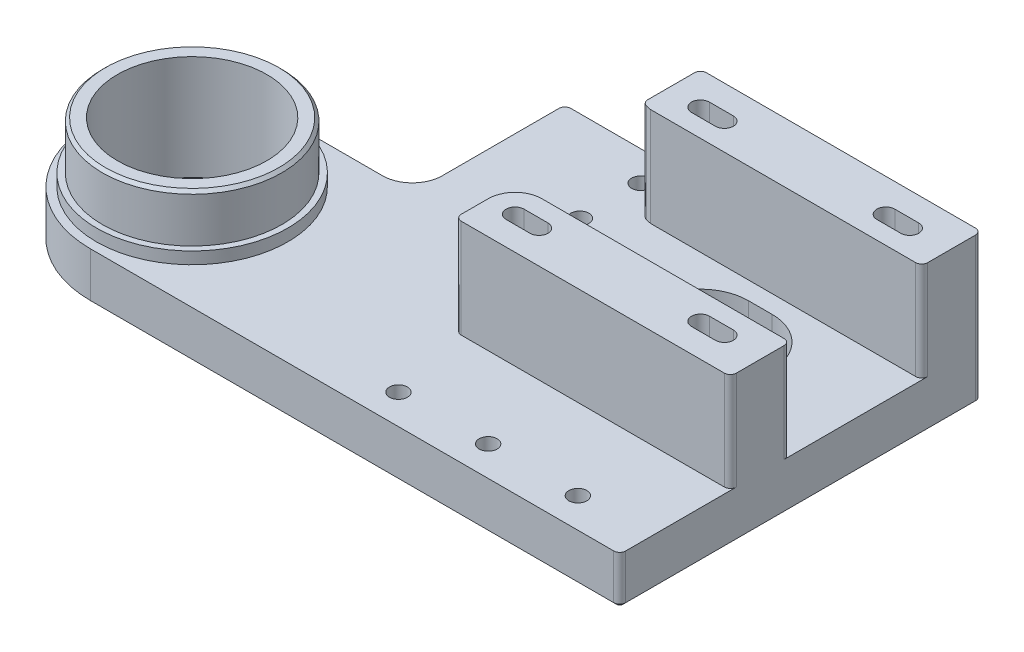
from build123d import *
from OCP.BRepFilletAPI import BRepFilletAPI_MakeChamfer
from build123d.topology import SkipClean

# Parameters (mm, degrees)
SKETCH1_R           = 1.425
SKETCH1_R_2         = 12.5
SKETCH1_R_3         = 1.5
BOSS_EXTRUDE1_DEPTH = 8
SKETCH11_R          = 3
CUT_EXTRUDE1_DEPTH  = 2
CHAMFER6_SIZE       = 0.5
CHAMFER6_SIZE2      = 1.37373871
CUT_EXTRUDE2_DEPTH  = 2
CHAMFER7_SIZE       = 0.5
CHAMFER7_SIZE2      = 1.37373871
SKETCH2_R           = 16
SKETCH2_R_2         = 12.5
BOSS_EXTRUDE2_DEPTH = 2
SKETCH5_R           = 3.425
SKETCH5_R_2         = 1.425
BOSS_EXTRUDE3_DEPTH = 2.5
CHAMFER3_SIZE       = 1
BOSS_EXTRUDE5_DEPTH = 16.5
BOSS_EXTRUDE6_DEPTH = 16.5
FILLET5_R           = 18
SKETCH6_R           = 15
SKETCH6_R_2         = 12.5
BOSS_EXTRUDE4_DEPTH = 8
FILLET8_R           = 4
CHAMFER5_SIZE       = 0.5
FILLET6_R           = 5
FILLET9_R           = 1
CHAMFER2_SIZE       = 0.5


with BuildPart() as part:
    # Sketch1 → Boss-Extrude1 (new body)
    with BuildSketch(Plane(origin=(0, 0, 0), x_dir=(1, 0, 0), z_dir=(0, 1, 0))):
        Polygon((-17.5, 17.5), (-17.5, -17.5), (89, -17.5), (89, 43), (19.331697659, 43), (19.331697659, 17.5), align=None)
        with Locations(Location((47, 20, 0), (0, 0, 270))):
            Circle(SKETCH1_R, mode=Mode.SUBTRACT)
        with Locations(Location((0, 0, 0), (0, 0, 270))):
            Circle(SKETCH1_R_2, mode=Mode.SUBTRACT)
        with Locations(Location((47, -12.5, 0), (0, 0, 270))):
            Circle(SKETCH1_R_3, mode=Mode.SUBTRACT)
        with Locations(Location((62, -12.5, 0), (0, 0, 270))):
            Circle(SKETCH1_R_3, mode=Mode.SUBTRACT)
        with Locations(Location((77, -12.5, 0), (0, 0, 270))):
            Circle(SKETCH1_R_3, mode=Mode.SUBTRACT)
        with Locations(Location((37, 38, 0), (0, 0, 270))):
            Circle(SKETCH1_R_3, mode=Mode.SUBTRACT)
        with Locations(Location((37, 27.837285004, 0), (0, 0, 270))):
            Circle(SKETCH1_R_3, mode=Mode.SUBTRACT)
        with BuildLine():
            Line((47.5, 39), (51.5, 39))
            ThreePointArc((51.5, 39), (53, 37.5), (51.5, 36))
            Line((51.5, 36), (47.5, 36))
            ThreePointArc((47.5, 36), (46, 37.5), (47.5, 39))
        make_face(mode=Mode.SUBTRACT)
        with BuildLine():
            Line((78.5, 39), (82.5, 39))
            ThreePointArc((82.5, 39), (84, 37.5), (82.5, 36))
            Line((82.5, 36), (78.5, 36))
            ThreePointArc((78.5, 36), (77, 37.5), (78.5, 39))
        make_face(mode=Mode.SUBTRACT)
        with BuildLine():
            Line((47.5, 8), (51.5, 8))
            ThreePointArc((51.5, 8), (53, 6.5), (51.5, 5))
            Line((51.5, 5), (47.5, 5))
            ThreePointArc((47.5, 5), (46, 6.5), (47.5, 8))
        make_face(mode=Mode.SUBTRACT)
        with BuildLine():
            Line((78.5, 8), (82.5, 8))
            ThreePointArc((82.5, 8), (84, 6.5), (82.5, 5))
            Line((82.5, 5), (78.5, 5))
            ThreePointArc((78.5, 5), (77, 6.5), (78.5, 8))
        make_face(mode=Mode.SUBTRACT)
        with BuildLine():
            Line((63, 30), (67, 30))
            ThreePointArc((67, 30), (75, 22), (67, 14))
            Line((67, 14), (63, 14))
            ThreePointArc((63, 14), (55, 22), (63, 30))
        make_face(mode=Mode.SUBTRACT)
    extrude(amount=BOSS_EXTRUDE1_DEPTH)

    # Sketch11 → Cut-Extrude1 (cut)
    with BuildSketch(Plane.XZ):
        with Locations(Location((47, 12.5, 0), (0, 0, 270))):
            Circle(SKETCH11_R)
        with Locations(Location((62, 12.5, 0), (0, 0, 270))):
            Circle(SKETCH11_R)
        with Locations(Location((77, 12.5, 0), (0, 0, 270))):
            Circle(SKETCH11_R)
        with Locations(Location((37, -27.837285004, 0), (0, 0, 270))):
            Circle(SKETCH11_R)
        with Locations(Location((37, -38, 0), (0, 0, 270))):
            Circle(SKETCH11_R)
    extrude(amount=-CUT_EXTRUDE1_DEPTH, mode=Mode.SUBTRACT)

    # Chamfer6: one chamfer whose edges measure the first distance from different faces: ONE call of the kernel's chamfer builder (chamfer() names one face for all edges)
    chamfer6_edges_1 = [part.edges().sort_by_distance(p)[0] for p in [
        (37, 2, -24.837285004),
    ]]
    chamfer6_side_1 = [part.faces().sort_by_distance(p)[0] for p in [
        (37, 1, -24.837285004),
    ]]
    chamfer6_edges_2 = [part.edges().sort_by_distance(p)[0] for p in [
        (37, 2, -35),
    ]]
    chamfer6_side_2 = [part.faces().sort_by_distance(p)[0] for p in [
        (37, 1, -35),
    ]]
    chamfer6_edges_3 = [part.edges().sort_by_distance(p)[0] for p in [
        (77, 2, 15.5),
    ]]
    chamfer6_side_3 = [part.faces().sort_by_distance(p)[0] for p in [
        (77, 1, 15.5),
    ]]
    chamfer6_edges_4 = [part.edges().sort_by_distance(p)[0] for p in [
        (62, 2, 15.5),
    ]]
    chamfer6_side_4 = [part.faces().sort_by_distance(p)[0] for p in [
        (62, 1, 15.5),
    ]]
    chamfer6_edges_5 = [part.edges().sort_by_distance(p)[0] for p in [
        (47, 2, 15.5),
    ]]
    chamfer6_side_5 = [part.faces().sort_by_distance(p)[0] for p in [
        (47, 1, 15.5),
    ]]
    chamfer6 = BRepFilletAPI_MakeChamfer(part.part.solid().wrapped)
    for e in chamfer6_edges_1:
        chamfer6.Add(CHAMFER6_SIZE, CHAMFER6_SIZE2, e.wrapped, chamfer6_side_1[0].wrapped)  # the first distance lies on this face
    for e in chamfer6_edges_2:
        chamfer6.Add(CHAMFER6_SIZE, CHAMFER6_SIZE2, e.wrapped, chamfer6_side_2[0].wrapped)  # the first distance lies on this face
    for e in chamfer6_edges_3:
        chamfer6.Add(CHAMFER6_SIZE, CHAMFER6_SIZE2, e.wrapped, chamfer6_side_3[0].wrapped)  # the first distance lies on this face
    for e in chamfer6_edges_4:
        chamfer6.Add(CHAMFER6_SIZE, CHAMFER6_SIZE2, e.wrapped, chamfer6_side_4[0].wrapped)  # the first distance lies on this face
    for e in chamfer6_edges_5:
        chamfer6.Add(CHAMFER6_SIZE, CHAMFER6_SIZE2, e.wrapped, chamfer6_side_5[0].wrapped)  # the first distance lies on this face
    add(Compound.cast(chamfer6.Shape()), mode=Mode.REPLACE)

    # Sketch12 → Cut-Extrude2 (cut)
    with BuildSketch(Plane.XZ):
        with BuildLine():
            Line((47.5, -3), (51.5, -3))
            ThreePointArc((51.5, -3), (55, -6.5), (51.5, -10))
            Line((51.5, -10), (47.5, -10))
            ThreePointArc((47.5, -10), (44, -6.5), (47.5, -3))
        make_face()
        with BuildLine():
            Line((78.5, -3), (82.5, -3))
            ThreePointArc((82.5, -3), (86, -6.5), (82.5, -10))
            Line((82.5, -10), (78.5, -10))
            ThreePointArc((78.5, -10), (75, -6.5), (78.5, -3))
        make_face()
        with BuildLine():
            Line((47.5, -34), (51.5, -34))
            ThreePointArc((51.5, -34), (55, -37.5), (51.5, -41))
            Line((51.5, -41), (47.5, -41))
            ThreePointArc((47.5, -41), (44, -37.5), (47.5, -34))
        make_face()
        with BuildLine():
            Line((78.5, -34), (82.5, -34))
            ThreePointArc((82.5, -34), (86, -37.5), (82.5, -41))
            Line((82.5, -41), (78.5, -41))
            ThreePointArc((78.5, -41), (75, -37.5), (78.5, -34))
        make_face()
    extrude(amount=-CUT_EXTRUDE2_DEPTH, mode=Mode.SUBTRACT)

    # Chamfer7: one chamfer whose edges measure the first distance from different faces: ONE call of the kernel's chamfer builder (chamfer() names one face for all edges)
    chamfer7_edges_1 = [part.edges().sort_by_distance(p)[0] for p in [
        (75, 2, -6.5),
    ]]
    chamfer7_side_1 = [part.faces().sort_by_distance(p)[0] for p in [
        (75, 1, -6.5),
    ]]
    chamfer7_edges_2 = [part.edges().sort_by_distance(p)[0] for p in [
        (80.5, 2, -3),
    ]]
    chamfer7_side_2 = [part.faces().sort_by_distance(p)[0] for p in [
        (80.5, 1, -3),
    ]]
    chamfer7_edges_3 = [part.edges().sort_by_distance(p)[0] for p in [
        (86, 2, -6.5),
    ]]
    chamfer7_side_3 = [part.faces().sort_by_distance(p)[0] for p in [
        (86, 1, -6.5),
    ]]
    chamfer7_edges_4 = [part.edges().sort_by_distance(p)[0] for p in [
        (80.5, 2, -10),
    ]]
    chamfer7_side_4 = [part.faces().sort_by_distance(p)[0] for p in [
        (80.5, 1, -10),
    ]]
    chamfer7_edges_5 = [part.edges().sort_by_distance(p)[0] for p in [
        (44, 2, -37.5),
    ]]
    chamfer7_side_5 = [part.faces().sort_by_distance(p)[0] for p in [
        (44, 1, -37.5),
    ]]
    chamfer7_edges_6 = [part.edges().sort_by_distance(p)[0] for p in [
        (49.5, 2, -34),
    ]]
    chamfer7_side_6 = [part.faces().sort_by_distance(p)[0] for p in [
        (49.5, 1, -34),
    ]]
    chamfer7_edges_7 = [part.edges().sort_by_distance(p)[0] for p in [
        (55, 2, -37.5),
    ]]
    chamfer7_side_7 = [part.faces().sort_by_distance(p)[0] for p in [
        (55, 1, -37.5),
    ]]
    chamfer7_edges_8 = [part.edges().sort_by_distance(p)[0] for p in [
        (49.5, 2, -41),
    ]]
    chamfer7_side_8 = [part.faces().sort_by_distance(p)[0] for p in [
        (49.5, 1, -41),
    ]]
    chamfer7_edges_9 = [part.edges().sort_by_distance(p)[0] for p in [
        (75, 2, -37.5),
    ]]
    chamfer7_side_9 = [part.faces().sort_by_distance(p)[0] for p in [
        (75, 1, -37.5),
    ]]
    chamfer7_edges_10 = [part.edges().sort_by_distance(p)[0] for p in [
        (80.5, 2, -34),
    ]]
    chamfer7_side_10 = [part.faces().sort_by_distance(p)[0] for p in [
        (80.5, 1, -34),
    ]]
    chamfer7_edges_11 = [part.edges().sort_by_distance(p)[0] for p in [
        (86, 2, -37.5),
    ]]
    chamfer7_side_11 = [part.faces().sort_by_distance(p)[0] for p in [
        (86, 1, -37.5),
    ]]
    chamfer7_edges_12 = [part.edges().sort_by_distance(p)[0] for p in [
        (80.5, 2, -41),
    ]]
    chamfer7_side_12 = [part.faces().sort_by_distance(p)[0] for p in [
        (80.5, 1, -41),
    ]]
    chamfer7_edges_13 = [part.edges().sort_by_distance(p)[0] for p in [
        (44, 2, -6.5),
    ]]
    chamfer7_side_13 = [part.faces().sort_by_distance(p)[0] for p in [
        (44, 1, -6.5),
    ]]
    chamfer7_edges_14 = [part.edges().sort_by_distance(p)[0] for p in [
        (49.5, 2, -3),
    ]]
    chamfer7_side_14 = [part.faces().sort_by_distance(p)[0] for p in [
        (49.5, 1, -3),
    ]]
    chamfer7_edges_15 = [part.edges().sort_by_distance(p)[0] for p in [
        (55, 2, -6.5),
    ]]
    chamfer7_side_15 = [part.faces().sort_by_distance(p)[0] for p in [
        (55, 1, -6.5),
    ]]
    chamfer7_edges_16 = [part.edges().sort_by_distance(p)[0] for p in [
        (49.5, 2, -10),
    ]]
    chamfer7_side_16 = [part.faces().sort_by_distance(p)[0] for p in [
        (49.5, 1, -10),
    ]]
    chamfer7 = BRepFilletAPI_MakeChamfer(part.part.solid().wrapped)
    for e in chamfer7_edges_1:
        chamfer7.Add(CHAMFER7_SIZE, CHAMFER7_SIZE2, e.wrapped, chamfer7_side_1[0].wrapped)  # the first distance lies on this face
    for e in chamfer7_edges_2:
        chamfer7.Add(CHAMFER7_SIZE, CHAMFER7_SIZE2, e.wrapped, chamfer7_side_2[0].wrapped)  # the first distance lies on this face
    for e in chamfer7_edges_3:
        chamfer7.Add(CHAMFER7_SIZE, CHAMFER7_SIZE2, e.wrapped, chamfer7_side_3[0].wrapped)  # the first distance lies on this face
    for e in chamfer7_edges_4:
        chamfer7.Add(CHAMFER7_SIZE, CHAMFER7_SIZE2, e.wrapped, chamfer7_side_4[0].wrapped)  # the first distance lies on this face
    for e in chamfer7_edges_5:
        chamfer7.Add(CHAMFER7_SIZE, CHAMFER7_SIZE2, e.wrapped, chamfer7_side_5[0].wrapped)  # the first distance lies on this face
    for e in chamfer7_edges_6:
        chamfer7.Add(CHAMFER7_SIZE, CHAMFER7_SIZE2, e.wrapped, chamfer7_side_6[0].wrapped)  # the first distance lies on this face
    for e in chamfer7_edges_7:
        chamfer7.Add(CHAMFER7_SIZE, CHAMFER7_SIZE2, e.wrapped, chamfer7_side_7[0].wrapped)  # the first distance lies on this face
    for e in chamfer7_edges_8:
        chamfer7.Add(CHAMFER7_SIZE, CHAMFER7_SIZE2, e.wrapped, chamfer7_side_8[0].wrapped)  # the first distance lies on this face
    for e in chamfer7_edges_9:
        chamfer7.Add(CHAMFER7_SIZE, CHAMFER7_SIZE2, e.wrapped, chamfer7_side_9[0].wrapped)  # the first distance lies on this face
    for e in chamfer7_edges_10:
        chamfer7.Add(CHAMFER7_SIZE, CHAMFER7_SIZE2, e.wrapped, chamfer7_side_10[0].wrapped)  # the first distance lies on this face
    for e in chamfer7_edges_11:
        chamfer7.Add(CHAMFER7_SIZE, CHAMFER7_SIZE2, e.wrapped, chamfer7_side_11[0].wrapped)  # the first distance lies on this face
    for e in chamfer7_edges_12:
        chamfer7.Add(CHAMFER7_SIZE, CHAMFER7_SIZE2, e.wrapped, chamfer7_side_12[0].wrapped)  # the first distance lies on this face
    for e in chamfer7_edges_13:
        chamfer7.Add(CHAMFER7_SIZE, CHAMFER7_SIZE2, e.wrapped, chamfer7_side_13[0].wrapped)  # the first distance lies on this face
    for e in chamfer7_edges_14:
        chamfer7.Add(CHAMFER7_SIZE, CHAMFER7_SIZE2, e.wrapped, chamfer7_side_14[0].wrapped)  # the first distance lies on this face
    for e in chamfer7_edges_15:
        chamfer7.Add(CHAMFER7_SIZE, CHAMFER7_SIZE2, e.wrapped, chamfer7_side_15[0].wrapped)  # the first distance lies on this face
    for e in chamfer7_edges_16:
        chamfer7.Add(CHAMFER7_SIZE, CHAMFER7_SIZE2, e.wrapped, chamfer7_side_16[0].wrapped)  # the first distance lies on this face
    add(Compound.cast(chamfer7.Shape()), mode=Mode.REPLACE)

    # Sketch2 → Boss-Extrude2 (add)
    with BuildSketch(Plane.XZ.offset(-8)):
        with Locations(Location((0, 0, 0), (0, 0, 270))):
            Circle(SKETCH2_R)
        with Locations(Location((0, 0, 0), (0, 0, 270))):
            Circle(SKETCH2_R_2, mode=Mode.SUBTRACT)
    extrude(amount=-BOSS_EXTRUDE2_DEPTH)

    # Sketch5 → Boss-Extrude3 (add)
    with SkipClean():  # the faces are left unmerged after this step: merging them gives an invalid solid
        with BuildSketch(Plane(origin=(0, 8, 0), x_dir=(1, 0, 0), z_dir=(0, 1, 0))):
            with Locations(Location((47, 20, 0), (0, 0, 270))):
                Circle(SKETCH5_R)
            with Locations(Location((47, 20, 0), (0, 0, 270))):
                Circle(SKETCH5_R_2, mode=Mode.SUBTRACT)
        extrude(amount=BOSS_EXTRUDE3_DEPTH)

    # Chamfer3
    chamfer3_edges = [part.edges().sort_by_distance(p)[0] for p in [
        (47, 10.5, -23.425),
    ]]
    chamfer(chamfer3_edges, length=CHAMFER3_SIZE)

    # Sketch7 → Boss-Extrude5 (add)
    # profile 1 of 4: a face of its own
    with SkipClean():  # the faces are left unmerged after this step: merging them gives an invalid solid
        with BuildSketch(Plane(origin=(0, 8, 0), x_dir=(1, 0, 0), z_dir=(0, 1, 0))):
            with BuildLine():
                Line((78.5, 2), (82.5, 2))
                ThreePointArc((82.5, 2), (87, 6.5), (82.5, 11))
                Line((82.5, 11), (78.5, 11))
                ThreePointArc((78.5, 11), (74, 6.5), (78.5, 2))
            make_face()
            with BuildLine():
                Line((78.5, 5), (82.5, 5))
                ThreePointArc((82.5, 5), (84, 6.5), (82.5, 8))
                Line((82.5, 8), (78.5, 8))
                ThreePointArc((78.5, 8), (77, 6.5), (78.5, 5))
            make_face(mode=Mode.SUBTRACT)
        # profile 2 of 4: a face of its own
        with BuildSketch(Plane(origin=(0, 8, 0), x_dir=(1, 0, 0), z_dir=(0, 1, 0))):
            with BuildLine():
                Line((47.5, 2), (51.5, 2))
                ThreePointArc((51.5, 2), (56, 6.5), (51.5, 11))
                Line((51.5, 11), (47.5, 11))
                ThreePointArc((47.5, 11), (43, 6.5), (47.5, 2))
            make_face()
            with BuildLine():
                Line((47.5, 5), (51.5, 5))
                ThreePointArc((51.5, 5), (53, 6.5), (51.5, 8))
                Line((51.5, 8), (47.5, 8))
                ThreePointArc((47.5, 8), (46, 6.5), (47.5, 5))
            make_face(mode=Mode.SUBTRACT)
        # profile 3 of 4: a face of its own
        with BuildSketch(Plane(origin=(0, 8, 0), x_dir=(1, 0, 0), z_dir=(0, 1, 0))):
            with BuildLine():
                Line((78.5, 33), (82.5, 33))
                ThreePointArc((82.5, 33), (87, 37.5), (82.5, 42))
                Line((82.5, 42), (78.5, 42))
                ThreePointArc((78.5, 42), (74, 37.5), (78.5, 33))
            make_face()
            with BuildLine():
                Line((78.5, 36), (82.5, 36))
                ThreePointArc((82.5, 36), (84, 37.5), (82.5, 39))
                Line((82.5, 39), (78.5, 39))
                ThreePointArc((78.5, 39), (77, 37.5), (78.5, 36))
            make_face(mode=Mode.SUBTRACT)
        # profile 4 of 4: a face of its own
        with BuildSketch(Plane(origin=(0, 8, 0), x_dir=(1, 0, 0), z_dir=(0, 1, 0))):
            with BuildLine():
                Line((47.5, 33), (51.5, 33))
                ThreePointArc((51.5, 33), (56, 37.5), (51.5, 42))
                Line((51.5, 42), (47.5, 42))
                ThreePointArc((47.5, 42), (43, 37.5), (47.5, 33))
            make_face()
            with BuildLine():
                Line((47.5, 36), (51.5, 36))
                ThreePointArc((51.5, 36), (53, 37.5), (51.5, 39))
                Line((51.5, 39), (47.5, 39))
                ThreePointArc((47.5, 39), (46, 37.5), (47.5, 36))
            make_face(mode=Mode.SUBTRACT)
        extrude(amount=BOSS_EXTRUDE5_DEPTH)

    # Sketch10 → Boss-Extrude6 (add)
    # profile 1 of 2: a face of its own
    with BuildSketch(Plane(origin=(0, 8, 0), x_dir=(1, 0, 0), z_dir=(0, 1, 0))):
        Polygon((42, 33.382828727), (42, 43), (89, 43), (89, 38), (89, 33), (43.652607746, 33), align=None)
        with BuildLine():
            Line((47.5, 39), (51.5, 39))
            ThreePointArc((51.5, 39), (53, 37.5), (51.5, 36))
            Line((51.5, 36), (47.5, 36))
            ThreePointArc((47.5, 36), (46, 37.5), (47.5, 39))
        make_face(mode=Mode.SUBTRACT)
        with BuildLine():
            Line((78.5, 39), (82.5, 39))
            ThreePointArc((82.5, 39), (84, 37.5), (82.5, 36))
            Line((82.5, 36), (78.5, 36))
            ThreePointArc((78.5, 36), (77, 37.5), (78.5, 39))
        make_face(mode=Mode.SUBTRACT)
    # profile 2 of 2: a face of its own
    with BuildSketch(Plane(origin=(0, 8, 0), x_dir=(1, 0, 0), z_dir=(0, 1, 0))):
        with BuildLine():
            Line((47.5, 11), (89, 11))
            Line((89, 11), (89, 1))
            Line((89, 1), (42.98837052, 1))
            Line((42.98837052, 1), (43.000010042, 6.509506791))
            ThreePointArc((43.000010042, 6.509506791), (44.32138242, 9.6853399), (47.5, 11))
        make_face()
        with BuildLine():
            Line((47.5, 5), (51.5, 5))
            ThreePointArc((51.5, 5), (53, 6.5), (51.5, 8))
            Line((51.5, 8), (47.5, 8))
            ThreePointArc((47.5, 8), (46, 6.5), (47.5, 5))
        make_face(mode=Mode.SUBTRACT)
        with BuildLine():
            Line((78.5, 5), (82.5, 5))
            ThreePointArc((82.5, 5), (84, 6.5), (82.5, 8))
            Line((82.5, 8), (78.5, 8))
            ThreePointArc((78.5, 8), (77, 6.5), (78.5, 5))
        make_face(mode=Mode.SUBTRACT)
    extrude(amount=BOSS_EXTRUDE6_DEPTH)

    # Fillet5
    # the kernel refuses this fillet: 18 mm, written as the material it takes off along each edge
    with BuildSketch(Plane(origin=(-17.5, -45, -17.5), x_dir=(0, 0, 1), z_dir=(0, 1, 0)), Plane(origin=(-17.5, -45, 17.5), x_dir=(1, 0, 0), z_dir=(0, 1, 0))) as fillet5_piece_1:
        with BuildLine():
            CenterArc((FILLET5_R, FILLET5_R), FILLET5_R, 180, 90)
            Line((0, FILLET5_R), (0, 0))
            Line((0, 0), (FILLET5_R, 0))
        make_face()
    extrude(amount=98, mode=Mode.SUBTRACT)

    # Sketch6 → Boss-Extrude4 (add)
    with SkipClean():  # the faces are left unmerged after this step: merging them gives an invalid solid
        with BuildSketch(Plane(origin=(0, 10, 0), x_dir=(1, 0, 0), z_dir=(0, 1, 0))):
            with Locations(Location((0, 0, 0), (0, 0, 270))):
                Circle(SKETCH6_R)
            with Locations(Location((0, 0, 0), (0, 0, 270))):
                Circle(SKETCH6_R_2, mode=Mode.SUBTRACT)
        extrude(amount=BOSS_EXTRUDE4_DEPTH)
    add(part.part.scale(1), mode=Mode.REPLACE)  # the faces are merged on a copy

    # Fillet8
    # the kernel refuses this fillet: 4 mm, written as the material it adds along each edge
    with BuildSketch(Plane(origin=(47, 8, -20), x_dir=(0, 0, 1), z_dir=(-1, 0, 0))) as fillet8_piece_1:
        with BuildLine():
            CenterArc((6.547498999, 4), FILLET8_R, 218.682187453, 51.317812547)
            Line((6.547498999, 0), (6.547498999, -0.08))
            Line((6.547498999, -0.08), (3.425, -0.08))
            Line((3.425, -0.08), (3.345, 0))
            ThreePointArc((3.345, 0), (3.345, 0.75), (3.36255002, 1.45))
            Line((3.36255002, 1.45), (3.425, 1.5))
        make_face()
    revolve(axis=Axis((47, 8, -20), (0, 1, 0)))

    # Chamfer5
    chamfer5_edges = [part.edges().sort_by_distance(p)[0] for p in [
        (0, 18, -15),
    ]]
    chamfer(chamfer5_edges, length=CHAMFER5_SIZE)

    # Fillet6
    fillet6_edges = [part.edges().sort_by_distance(p)[0] for p in [
        (19.331697659, 4, -17.5),
    ]]
    fillet(fillet6_edges, radius=FILLET6_R)

    # Fillet9
    fillet9_edges = [part.edges().sort_by_distance(p)[0] for p in [
        (19.331697659, 4, -43),
        (89, 12.25, -43),
        (89, 4, 17.5),
        (42, 16.25, -43),
        (89, 16.25, -33),
        (42, 16.25, -33.382828727),
        (89, 16.25, -11),
        (89, 16.25, -1),
        (42.98837052, 16.25, -1),
    ]]
    fillet(fillet9_edges, radius=FILLET9_R)

    # Chamfer2
    chamfer2_edges = [part.edges().sort_by_distance(p)[0] for p in [
        (37, 0, -24.837285004),
        (37, 0, -35),
        (77, 0, 15.5),
        (62, 0, 15.5),
        (47, 0, 15.5),
        (75, 0, -6.5),
        (80.5, 0, -10),
        (86, 0, -6.5),
        (80.5, 0, -3),
        (44, 0, -37.5),
        (49.5, 0, -41),
        (55, 0, -37.5),
        (49.5, 0, -34),
        (75, 0, -37.5),
        (80.5, 0, -41),
        (86, 0, -37.5),
        (80.5, 0, -34),
        (44, 0, -6.5),
        (49.5, 0, -10),
        (55, 0, -6.5),
        (49.5, 0, -3),
        (47, 0, -21.425),
        (44.25, 0, 17.5),
        (-12.049900398, 0, 12.403487901),
        (-12.049900398, 0, -12.403487901),
        (7.415848829, 0, -17.5),
        (17.867231565, 0, -18.964466094),
        (19.331697659, 0, -32.25),
        (54.165848829, 0, -43),
        (89, 0, -12.75),
        (88.707106781, 0, -42.707106781),
        (88.707106781, 0, 17.207106781),
        (19.624590878, 0, -42.707106781),
        (55, 0, -22),
        (65, 0, -14),
        (75, 0, -22),
        (65, 0, -30),
        (0, 0, -12.5),
    ]]
    chamfer(chamfer2_edges, length=CHAMFER2_SIZE)


solid = part.part
